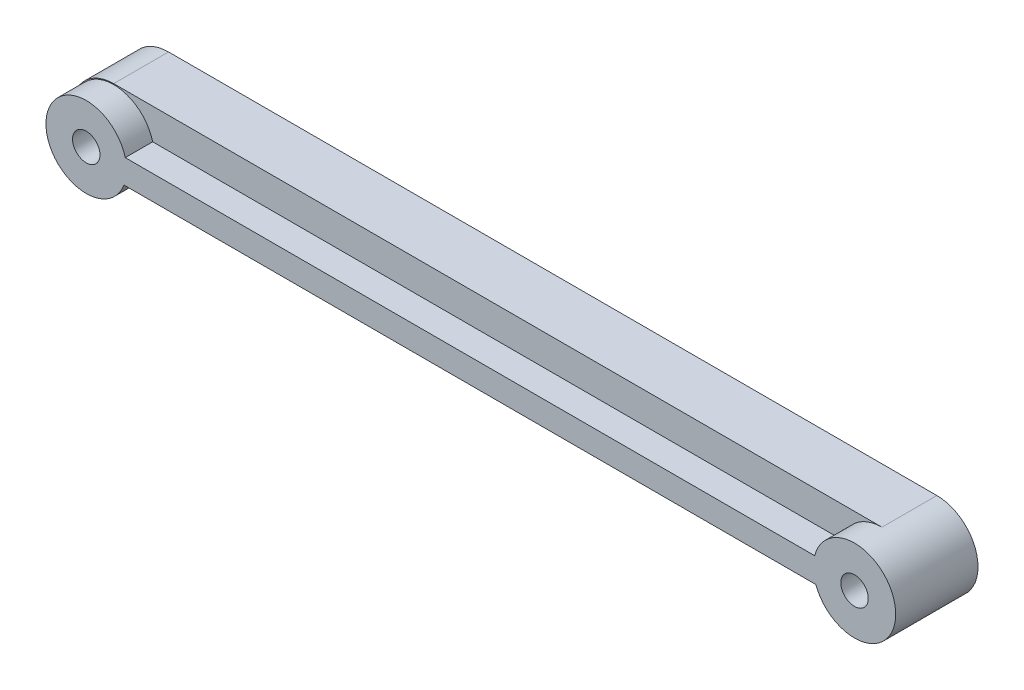
from build123d import *

# Parameters (mm, degrees)
SKETCH_1_R      = 0.5
EXTRUDE_1_DEPTH = 2
SKETCH_2_R      = 0.5
EXTRUDE_3_DEPTH = 1


with BuildPart() as part:
    # 草图1 → 凸台-拉伸1 (new body)
    with BuildSketch(Plane.XY):
        with BuildLine():
            Line((0, 1.5), (28, 1.5))
            ThreePointArc((28, 1.5), (29.5, 0), (28, -1.5))
            Line((28, -1.5), (0, -1.5))
            ThreePointArc((0, -1.5), (-1.5, 0), (0, 1.5))
        make_face()
        Circle(SKETCH_1_R, mode=Mode.SUBTRACT)
        with Locations((28, 0)):
            Circle(SKETCH_1_R, mode=Mode.SUBTRACT)
    extrude(amount=EXTRUDE_1_DEPTH)

    # 草图2 → 凸台-拉伸3 (add)
    with BuildSketch(Plane.XY.offset(2)):
        with BuildLine():
            Line((1.420341395, 0.37453303), (26.547510754, 0.37453303))
            ThreePointArc((26.547510754, 0.37453303), (29.498226645, 0.072917208), (26.590745591, -0.513811261))
            Line((26.590745591, -0.513811261), (1.376096892, -0.513811261))
            ThreePointArc((1.376096892, -0.513811261), (-1.467073845, 0.073068464), (1.420341395, 0.37453303))
        make_face()
        Circle(SKETCH_2_R, mode=Mode.SUBTRACT)
        with Locations((28, 0)):
            Circle(SKETCH_2_R, mode=Mode.SUBTRACT)
    extrude(amount=EXTRUDE_3_DEPTH)


solid = part.part
